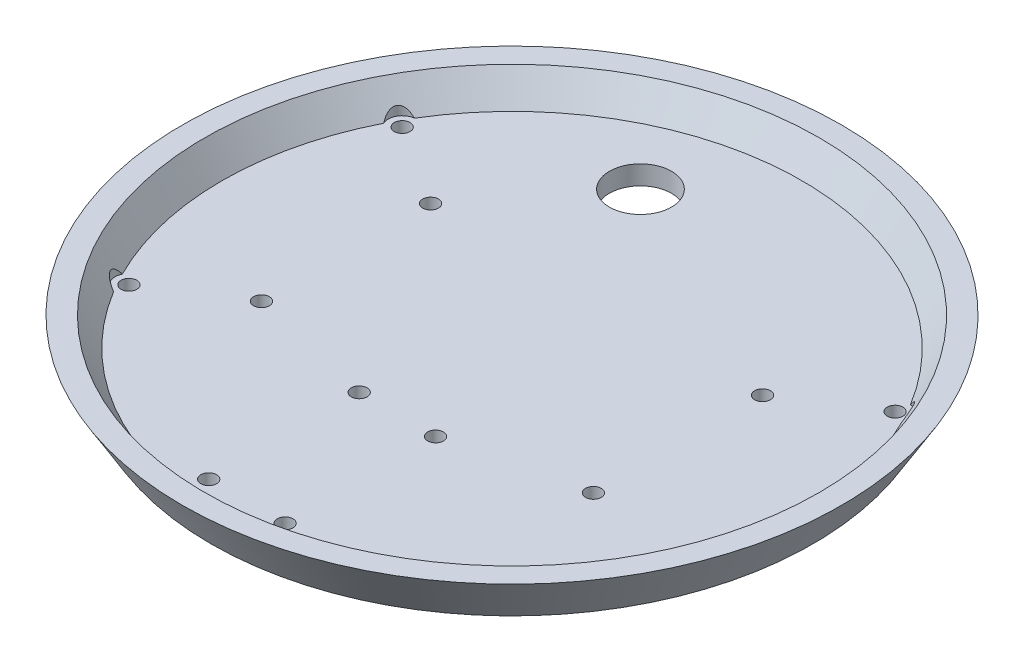
from build123d import *

# Parameters (mm, degrees)
SKETCH4_R          = 1.65
CUT_EXTRUDE1_DEPTH = 98.765024421
SKETCH5_R          = 2.9
CUT_EXTRUDE2_DEPTH = 98.765024421
SKETCH6_R          = 1.65
CUT_EXTRUDE3_DEPTH = 98.765024427
SKETCH7_R          = 6.5
CUT_EXTRUDE4_DEPTH = 10


with BuildPart() as part:
    # Sketch1 → Revolve1 (revolve)
    with BuildSketch(Plane.XY):
        Polygon((0, -4), (63, -4), (69, 6), (64.335238484, 6), (60.735238484, 0), (0, 0), align=None)
    revolve(axis=Axis((0, -4, 0), (0, 1, 0)))

    # Sketch4 → Cut-Extrude1 (cut, through all)
    with BuildSketch(Plane(origin=(0, 0, 0), x_dir=(1, 0, 0), z_dir=(0, 1, 0))):
        with Locations((34.749254443, 17.70562949)):
            Circle(SKETCH4_R)
        with Locations((51.602562721, 28.603767595)):
            Circle(SKETCH4_R)
        with Locations((51.602562721, -28.603767595)):
            Circle(SKETCH4_R)
        with Locations((34.749254443, -17.70562949)):
            Circle(SKETCH4_R)
        with Locations((-34.749254443, -17.70562949)):
            Circle(SKETCH4_R)
        with Locations((-51.602562721, -28.603767595)):
            Circle(SKETCH4_R)
        with Locations((-51.602562721, 28.603767595)):
            Circle(SKETCH4_R)
        with Locations((-34.749254443, 17.70562949)):
            Circle(SKETCH4_R)
    extrude(amount=-CUT_EXTRUDE1_DEPTH, mode=Mode.SUBTRACT)

    # Sketch5 → Cut-Extrude2 (cut, through all)
    with BuildSketch(Plane(origin=(0, 0, 0), x_dir=(1, 0, 0), z_dir=(0, 1, 0))):
        with Locations((51.602562721, 28.603767595)):
            Circle(SKETCH5_R)
        with Locations((51.602562721, -28.603767595)):
            Circle(SKETCH5_R)
        with Locations((-51.602562721, -28.603767595)):
            Circle(SKETCH5_R)
        with Locations((-51.602562721, 28.603767595)):
            Circle(SKETCH5_R)
    extrude(amount=CUT_EXTRUDE2_DEPTH, mode=Mode.SUBTRACT)

    # Sketch6 → Cut-Extrude3 (cut, through all)
    with BuildSketch(Plane(origin=(0, 0, 0), x_dir=(1, 0, 0), z_dir=(0, 1, 0))):
        with Locations((8, -55.5)):
            Circle(SKETCH6_R)
        with Locations((-8, -55.5)):
            Circle(SKETCH6_R)
        with Locations((8, -24)):
            Circle(SKETCH6_R)
        with Locations((-8, -24)):
            Circle(SKETCH6_R)
    extrude(amount=-CUT_EXTRUDE3_DEPTH, mode=Mode.SUBTRACT)

    # Sketch7 → Cut-Extrude4 (cut)
    with BuildSketch(Plane(origin=(0, 0, 0), x_dir=(1, 0, 0), z_dir=(0, 1, 0))):
        with Locations((-15.39090645, 42.286167935)):
            Circle(SKETCH7_R)
    extrude(amount=-CUT_EXTRUDE4_DEPTH, mode=Mode.SUBTRACT)


solid = part.part
